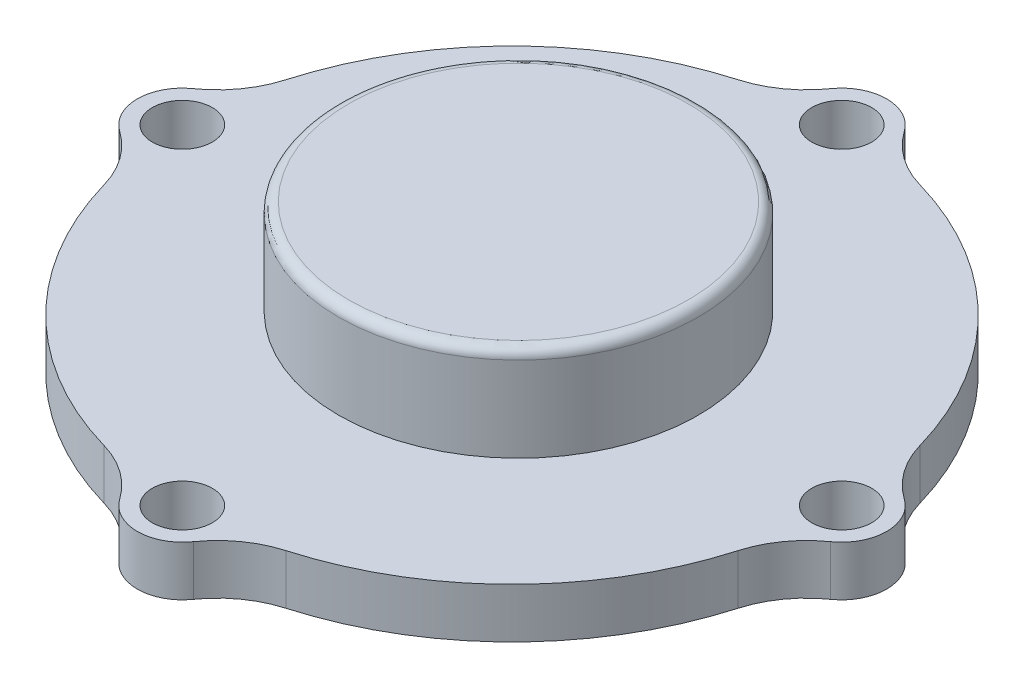
from build123d import *

# Parameters (mm, degrees)
BOSS_EXTRUDE1_OUTLINE_W = 75
BOSS_EXTRUDE1_OUTLINE_H = 75
BOSS_EXTRUDE1_OUTLINE_R = 3
BOSS_EXTRUDE1_DEPTH     = 5
SKETCH2_R               = 27.75
CUT_EXTRUDE1_DEPTH      = 3
SKETCH3_OUTSIDE_W       = 98.236
SKETCH3_OUTSIDE_H       = 98.236
CUT_EXTRUDE5_DEPTH      = 5
SKETCH4_R               = 18
BOSS_EXTRUDE2_DEPTH     = 9.5
SKETCH5_R               = 12
CUT_EXTRUDE6_DEPTH      = 8
FILLET1_R               = 1


# Read off the part's stored shape, not the designer's step: Boss-Extrude1
with BuildPart() as part:
    # Boss-Extrude1 outline → Boss-Extrude1 (new body)
    with BuildSketch(Plane(origin=(0, 0, 0), x_dir=(1, 0, 0), z_dir=(0, 1, 0))):
        Rectangle(BOSS_EXTRUDE1_OUTLINE_W, BOSS_EXTRUDE1_OUTLINE_H)
        with Locations((0.001, -33.001)):
            Circle(BOSS_EXTRUDE1_OUTLINE_R, mode=Mode.SUBTRACT)
        with Locations((-33, 0)):
            Circle(BOSS_EXTRUDE1_OUTLINE_R, mode=Mode.SUBTRACT)
        with BuildLine():
            ThreePointArc((8.840334751, 8.839334751), (12.502, 0), (8.840334751, -8.839334751))
            ThreePointArc((8.840334751, -8.839334751), (0.001, -12.501), (-8.838334751, -8.839334751))
            ThreePointArc((-8.838334751, -8.839334751), (-12.5, 0), (-8.838334751, 8.839334751))
            ThreePointArc((-8.838334751, 8.839334751), (0.001, 12.501), (8.840334751, 8.839334751))
        make_face(mode=Mode.SUBTRACT)
        with Locations((33.002, 0)):
            Circle(BOSS_EXTRUDE1_OUTLINE_R, mode=Mode.SUBTRACT)
        with Locations((0.001, 33.001)):
            Circle(BOSS_EXTRUDE1_OUTLINE_R, mode=Mode.SUBTRACT)
    extrude(amount=BOSS_EXTRUDE1_DEPTH)

    # Sketch2 → Cut-Extrude1 (cut)
    with BuildSketch(Plane.XZ):
        with Locations(Location((0, 0, 0), (0, 0, 270))):
            Circle(SKETCH2_R)
    extrude(amount=-CUT_EXTRUDE1_DEPTH, mode=Mode.SUBTRACT)

    # Sketch3 outside → Cut-Extrude5 (cut)
    with BuildSketch(Plane.XZ):
        Rectangle(SKETCH3_OUTSIDE_W, SKETCH3_OUTSIDE_H)
        with BuildLine():
            ThreePointArc((-31.718023256, -9.10862233), (-23.334523779, -23.334523779), (-9.10862233, -31.718023256))
            ThreePointArc((-9.10862233, -31.718023256), (-6.064515675, -33.186440594), (-3.683424077, -35.585031348))
            ThreePointArc((-3.683424077, -35.585031348), (0, -37.5), (3.683424077, -35.585031348))
            ThreePointArc((3.683424077, -35.585031348), (6.064515675, -33.186440594), (9.10862233, -31.718023256))
            ThreePointArc((9.10862233, -31.718023256), (23.334523779, -23.334523779), (31.718023256, -9.10862233))
            ThreePointArc((31.718023256, -9.10862233), (33.186440594, -6.064515675), (35.585031348, -3.683424077))
            ThreePointArc((35.585031348, -3.683424077), (37.5, 0), (35.585031348, 3.683424077))
            ThreePointArc((35.585031348, 3.683424077), (33.186440594, 6.064515675), (31.718023256, 9.10862233))
            ThreePointArc((31.718023256, 9.10862233), (23.334523779, 23.334523779), (9.10862233, 31.718023256))
            ThreePointArc((9.10862233, 31.718023256), (6.064515675, 33.186440594), (3.683424077, 35.585031348))
            ThreePointArc((3.683424077, 35.585031348), (0, 37.5), (-3.683424077, 35.585031348))
            ThreePointArc((-3.683424077, 35.585031348), (-6.064515675, 33.186440594), (-9.10862233, 31.718023256))
            ThreePointArc((-9.10862233, 31.718023256), (-23.334523779, 23.334523779), (-31.718023256, 9.10862233))
            ThreePointArc((-31.718023256, 9.10862233), (-33.186440594, 6.064515675), (-35.585031348, 3.683424077))
            ThreePointArc((-35.585031348, 3.683424077), (-37.5, 0), (-35.585031348, -3.683424077))
            ThreePointArc((-35.585031348, -3.683424077), (-33.186440594, -6.064515675), (-31.718023256, -9.10862233))
        make_face(mode=Mode.SUBTRACT)
    extrude(amount=-CUT_EXTRUDE5_DEPTH, mode=Mode.SUBTRACT)

    # Sketch4 → Boss-Extrude2 (add)
    with BuildSketch(Plane(origin=(0, 5, 0), x_dir=(1, 0, 0), z_dir=(0, 1, 0))):
        with Locations(Location((0, 0.647401089, 0), (0, 0, 270))):
            Circle(SKETCH4_R)
    extrude(amount=BOSS_EXTRUDE2_DEPTH)

    # Sketch5 → Cut-Extrude6 (cut)
    with BuildSketch(Plane.XZ.offset(-5)):
        with Locations(Location((0, 0, 0), (0, 0, 270))):
            Circle(SKETCH5_R)
    extrude(amount=-CUT_EXTRUDE6_DEPTH, mode=Mode.SUBTRACT)

    # Fillet1
    fillet1_edges = [part.edges().sort_by_distance(p)[0] for p in [
        (0, 14.5, -18.647401089),
    ]]
    fillet(fillet1_edges, radius=FILLET1_R)


solid = part.part
